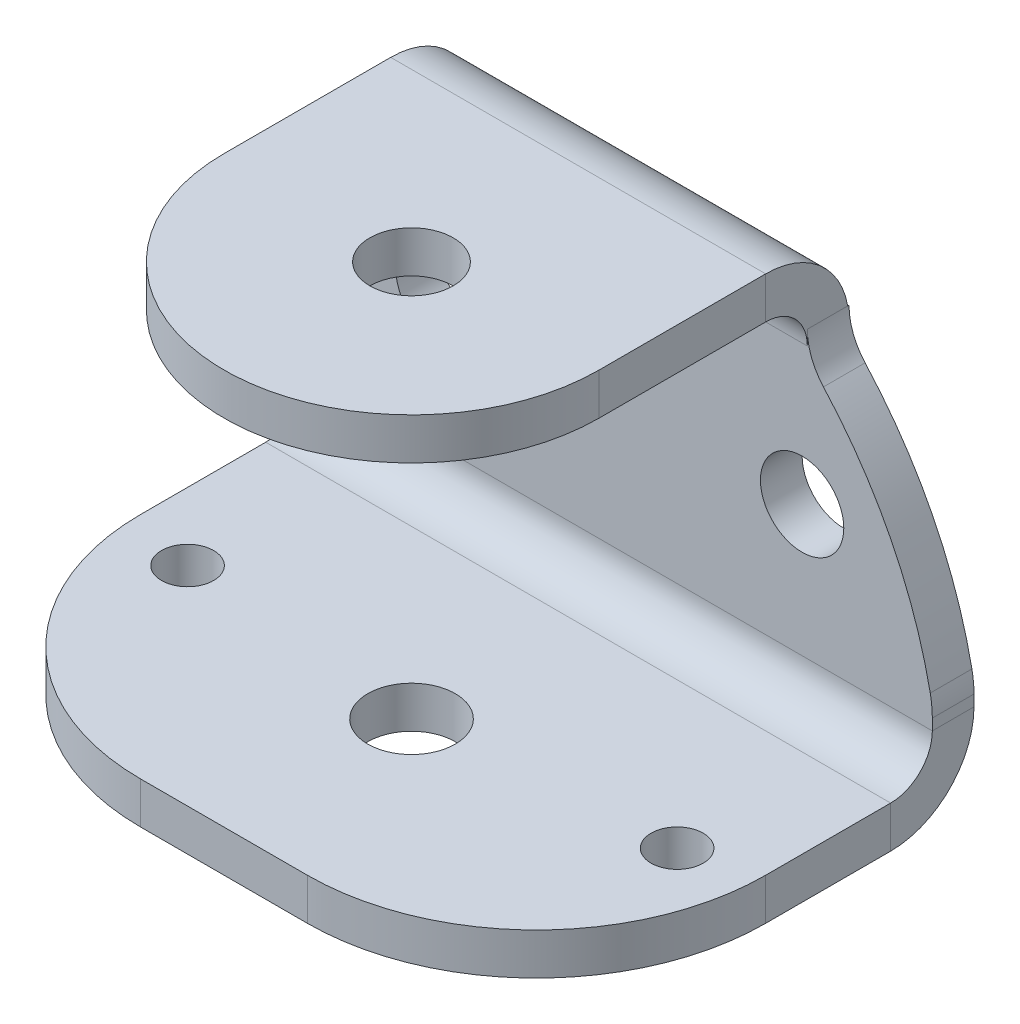
from build123d import *

# Parameters (mm, degrees)
BRIDA_BASE1_DEPTH                = 2
REDONDEO5MM_R                    = 5
REDONDEO3MM_R                    = 3
BRIDA_DE_ARISTA1_STRIP_W         = 12
BRIDA_DE_ARISTA1_STRIP_H         = 2
BRIDA_DE_ARISTA1_STRIP_CUT_DEPTH = 30
BRIDA_DE_ARISTA1_DEPTH           = 30
BRIDA_DE_ARISTA2_STRIP_W         = 12
BRIDA_DE_ARISTA2_STRIP_H         = 2
BRIDA_DE_ARISTA2_STRIP_CUT_DEPTH = 18
BRIDA_DE_ARISTA2_DEPTH           = 18
BRIDA_START                      = 2
BRIDA_DE_ARISTA2_FLAT_DEPTH      = 2
CORTAR_EXTRUIR6_REACH            = 43.255
CROQUIS26_R                      = 2
REDONDEO11MM_R                   = 11
TALADRO_ROSCADO_M32_D            = 2.5
TALADRO_ROSCADO_M32_DEPTH        = 20.65
TALADRO_ROSCADO_M32_TIP          = 0.751075774
TALADRO_ROSCADO_M52_D            = 4.2
TALADRO_ROSCADO_M52_DEPTH        = 2
CORTAR_EXTRUIR7_REACH            = 42.274
CROQUIS36_R                      = 2


# Sheet-metal steps are written as plain solids
with BuildPart() as part:
    # Croquis1 → Brida base1 (new body)
    with BuildSketch(Plane.XY):
        with BuildLine():
            Line((0, 0), (30, 0))
            Line((30, 0), (30, 3))
            ThreePointArc((30, 3), (27.886584846, 9.212566007), (24, 14.5))
            Line((24, 14.5), (24, 17))
            Line((24, 17), (6, 17))
            Line((6, 17), (6, 14.5))
            ThreePointArc((6, 14.5), (2.113415154, 9.212566007), (0, 3))
            Line((0, 3), (0, 0))
        make_face()
    extrude(amount=-BRIDA_BASE1_DEPTH)

    # Redondeo5mm
    redondeo5mm_edges = [part.edges().sort_by_distance(p)[0] for p in [
        (0, 3, -1),
        (30, 3, -1),
    ]]
    fillet(redondeo5mm_edges, radius=REDONDEO5MM_R)

    # Redondeo3mm
    redondeo3mm_edges = [part.edges().sort_by_distance(p)[0] for p in [
        (6, 14.5, -1),
        (24, 14.5, -1),
    ]]
    fillet(redondeo3mm_edges, radius=REDONDEO3MM_R)

    # Brida de arista1 strip (across the edge) → Brida de arista1 strip cut (cut)
    with BuildSketch(Plane.YZ):
        with Locations((-4, -1)):
            Rectangle(BRIDA_DE_ARISTA1_STRIP_W, BRIDA_DE_ARISTA1_STRIP_H)
    extrude(amount=BRIDA_DE_ARISTA1_STRIP_CUT_DEPTH, mode=Mode.SUBTRACT)

    # Brida de arista1 section (across the edge) → Brida de arista1 (add)
    with BuildSketch(Plane.YZ):
        with BuildLine():
            Line((-2, 2), (-2, 19))
            Line((-2, 19), (0, 19))
            Line((0, 19), (0, 2))
            ThreePointArc((0, 2), (0.585786438, 0.585786438), (2, 0))
            Line((2, 0), (2, -2))
            ThreePointArc((2, -2), (-0.828427125, -0.828427125), (-2, 2))
        make_face()
    extrude(amount=BRIDA_DE_ARISTA1_DEPTH)

    # Brida de arista2 strip (across the edge) → Brida de arista2 strip cut (cut)
    with BuildSketch(Plane(origin=(24, 17, 0), x_dir=(0, -1, 0), z_dir=(-1, 0, 0))):
        with Locations((-4, -1)):
            Rectangle(BRIDA_DE_ARISTA2_STRIP_W, BRIDA_DE_ARISTA2_STRIP_H)
    extrude(amount=BRIDA_DE_ARISTA2_STRIP_CUT_DEPTH, mode=Mode.SUBTRACT)

    # Brida de arista2 bend section (across the edge) → Brida de arista2 (add)
    with BuildSketch(Plane(origin=(24, 17, 0), x_dir=(0, -1, 0), z_dir=(-1, 0, 0))):
        with BuildLine():
            Line((-2, 2), (0, 2))
            ThreePointArc((0, 2), (0.585786438, 0.585786438), (2, 0))
            Line((2, 0), (2, -2))
            ThreePointArc((2, -2), (-0.828427125, -0.828427125), (-2, 2))
        make_face()
    extrude(amount=BRIDA_DE_ARISTA2_DEPTH)

    # Brida de arista2 profile (on flange) → Brida de arista2 flat (add)
    with BuildSketch(Plane(origin=(0, 17, 0), x_dir=(-1, 0, 0), z_dir=(0, 1, 0)).offset(BRIDA_START)):
        with BuildLine():
            ThreePointArc((-6, 10), (-15, 19), (-24, 10))
            Line((-24, 10), (-24, 2))
            Line((-24, 2), (-6, 2))
            Line((-6, 2), (-6, 10))
        make_face()
    extrude(amount=-BRIDA_DE_ARISTA2_FLAT_DEPTH)

    # Croquis26 → Cortar-Extruir6 (cut, up to next)
    with BuildSketch(Plane(origin=(0, 0, -2), x_dir=(-1, 0, 0), z_dir=(0, 0, -1)), mode=Mode.PRIVATE) as cortar_extruir6_sk1:
        with Locations((-6.25, 8.3)):
            Circle(CROQUIS26_R)
    cortar_extruir6_tool1 = extrude(cortar_extruir6_sk1.sketch, amount=-CORTAR_EXTRUIR6_REACH, mode=Mode.PRIVATE) & part.part
    # Croquis26 → Cortar-Extruir6 (cut, up to next)
    with BuildSketch(Plane(origin=(0, 0, -2), x_dir=(-1, 0, 0), z_dir=(0, 0, -1)), mode=Mode.PRIVATE) as cortar_extruir6_sk2:
        with Locations((-23.75, 8.3)):
            Circle(CROQUIS26_R)
    cortar_extruir6_tool2 = extrude(cortar_extruir6_sk2.sketch, amount=-CORTAR_EXTRUIR6_REACH, mode=Mode.PRIVATE) & part.part
    add(cortar_extruir6_tool1.solids().sort_by_distance((6.25, 8.3, -2))[0], mode=Mode.SUBTRACT)
    add(cortar_extruir6_tool2.solids().sort_by_distance((23.75, 8.3, -2))[0], mode=Mode.SUBTRACT)

    # Redondeo11mm
    redondeo11mm_edges = [part.edges().sort_by_distance(p)[0] for p in [
        (0, -1, 19),
        (30, -1, 19),
    ]]
    fillet(redondeo11mm_edges, radius=REDONDEO11MM_R)

    # Taladro roscado M32
    with Locations(Plane(origin=(0, 0, 0), x_dir=(1, 0, 0), z_dir=(0, 1, 0))):
        with Locations((3.25, -9), (26.75, -9)):
            Hole(TALADRO_ROSCADO_M32_D / 2, depth=TALADRO_ROSCADO_M32_DEPTH)
            with Locations((0, 0, -(TALADRO_ROSCADO_M32_DEPTH + TALADRO_ROSCADO_M32_TIP / 2))):  # 118° drill point
                Cone(0, TALADRO_ROSCADO_M32_D / 2, TALADRO_ROSCADO_M32_TIP, mode=Mode.SUBTRACT)

    # Taladro roscado M52
    with Locations(Plane(origin=(3.715500562, 0, 2.638137214), x_dir=(1, 0, 0), z_dir=(0, 1, 0))):
        with Locations((11.284499438, -7.361862786)):
            Hole(TALADRO_ROSCADO_M52_D / 2, depth=TALADRO_ROSCADO_M52_DEPTH)

    # Croquis36 → Cortar-Extruir7 (cut, up to next)
    with BuildSketch(Plane(origin=(0, 17, 0), x_dir=(1, 0, 0), z_dir=(0, 1, 0)), mode=Mode.PRIVATE) as cortar_extruir7_sk1:
        with Locations(Location((15, -10, 0), (0, 0, 270))):
            Circle(CROQUIS36_R)
    cortar_extruir7_tool1 = extrude(cortar_extruir7_sk1.sketch, amount=CORTAR_EXTRUIR7_REACH, mode=Mode.PRIVATE) & part.part
    add(cortar_extruir7_tool1.solids().sort_by_distance((15, 17, 10))[0], mode=Mode.SUBTRACT)


solid = part.part
